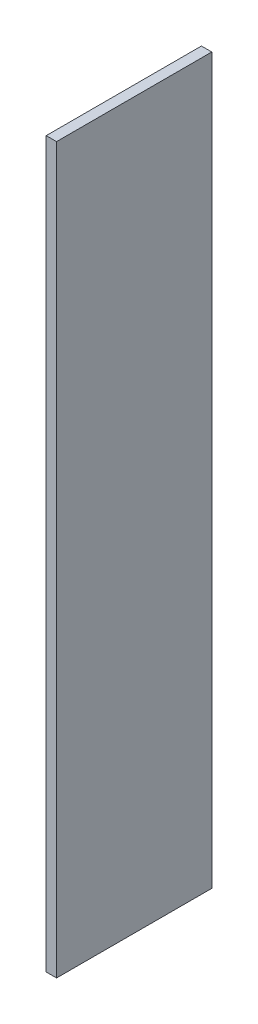
from build123d import *

# Parameters (mm, degrees)
SKETCH1_W           = 0.2
SKETCH1_H           = 14
BOSS_EXTRUDE1_DEPTH = 3


with BuildPart() as part:
    # Sketch1 → Boss-Extrude1 (new body)
    with BuildSketch(Plane.XY):
        with Locations((0.1, 7)):
            Rectangle(SKETCH1_W, SKETCH1_H)
    extrude(amount=BOSS_EXTRUDE1_DEPTH)


solid = part.part
